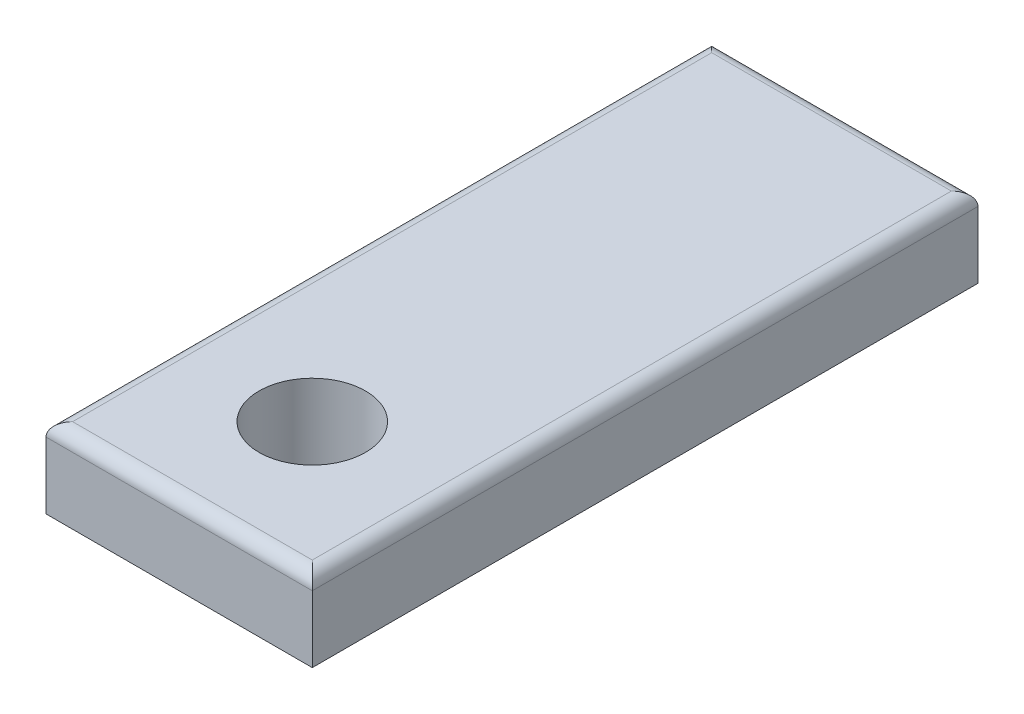
from build123d import *

# Parameters (mm, degrees)
SKETCH1_W           = 10
SKETCH1_H           = 25
BOSS_EXTRUDE1_DEPTH = 3
SKETCH2_R           = 2
CUT_EXTRUDE1_DEPTH  = 3
FILLET1_R           = 0.5


with BuildPart() as part:
    # Sketch1 → Boss-Extrude1 (new body)
    with BuildSketch(Plane(origin=(0, 0, 0), x_dir=(1, 0, 0), z_dir=(0, 1, 0))):
        Rectangle(SKETCH1_W, SKETCH1_H)
    extrude(amount=BOSS_EXTRUDE1_DEPTH)

    # Sketch2 → Cut-Extrude1 (cut)
    with BuildSketch(Plane(origin=(0, 3, 0), x_dir=(1, 0, 0), z_dir=(0, 1, 0))):
        with Locations((0, -7.5)):
            Circle(SKETCH2_R)
    extrude(amount=-CUT_EXTRUDE1_DEPTH, mode=Mode.SUBTRACT)

    # Fillet1
    fillet1_edges = [part.edges().sort_by_distance(p)[0] for p in [
        (0, 3, 12.5),
        (-5, 3, 0),
        (0, 3, -12.5),
        (5, 3, 0),
    ]]
    fillet(fillet1_edges, radius=FILLET1_R)


solid = part.part
